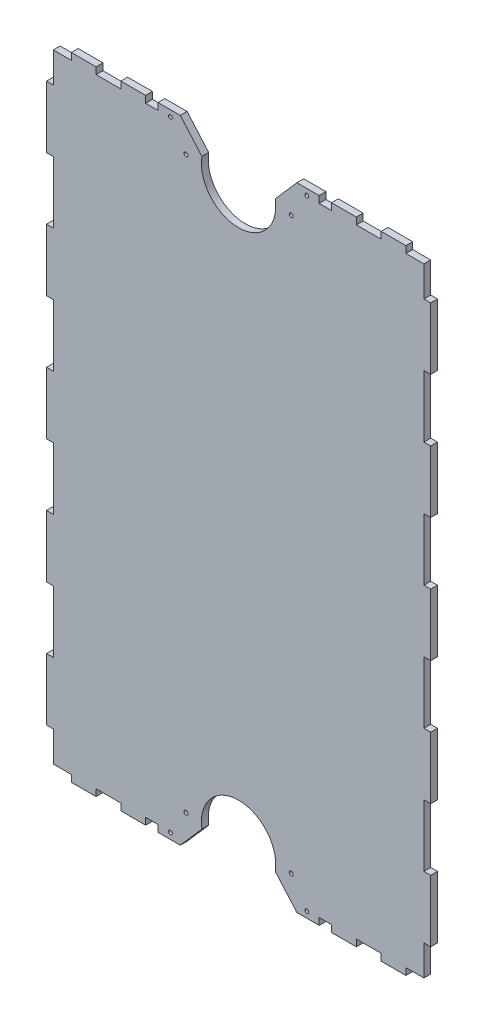
from build123d import *

# Parameters (mm, degrees)
SKETCH_1_W          = 310
SKETCH_1_H          = 510
EXTRUDE_1_DEPTH     = 5.5
SKETCH_2_W          = 5.5
SKETCH_2_H          = 50
CUT_EXTRUDE_1_DEPTH = 299.463146804
CUT_EXTRUDE_2_DEPTH = 299.463146804
SKETCH_5_R          = 1.6
CUT_EXTRUDE_3_DEPTH = 299.463146804
SKETCH_6_R          = 1.55
CUT_EXTRUDE_4_DEPTH = 299.463146804
SKETCH_7_W          = 20
SKETCH_7_H          = 5.5
SKETCH_7_W_2        = 10
CUT_EXTRUDE_5_DEPTH = 299.463146804


with BuildPart() as part:
    # ｽｹｯﾁ1 → ﾎﾞｽ - 押し出し1 (new body)
    with BuildSketch(Plane.XY):
        Rectangle(SKETCH_1_W, SKETCH_1_H)
    extrude(amount=EXTRUDE_1_DEPTH)

    # ｽｹｯﾁ2 → ｶｯﾄ - 押し出し1 (cut, through all)
    with BuildSketch(Plane.XY.offset(5.5)):
        with Locations((152.25, 50)):
            Rectangle(SKETCH_2_W, SKETCH_2_H)
        with Locations((152.25, -50)):
            Rectangle(SKETCH_2_W, SKETCH_2_H)
        with Locations((152.25, 150)):
            Rectangle(SKETCH_2_W, SKETCH_2_H)
        with Locations((152.25, -150)):
            Rectangle(SKETCH_2_W, SKETCH_2_H)
        with Locations((152.25, 250)):
            Rectangle(SKETCH_2_W, SKETCH_2_H)
        with Locations((152.25, -250)):
            Rectangle(SKETCH_2_W, SKETCH_2_H)
        with Locations((-152.25, 50)):
            Rectangle(SKETCH_2_W, SKETCH_2_H)
        with Locations((-152.25, -50)):
            Rectangle(SKETCH_2_W, SKETCH_2_H)
        with Locations((-152.25, 150)):
            Rectangle(SKETCH_2_W, SKETCH_2_H)
        with Locations((-152.25, -150)):
            Rectangle(SKETCH_2_W, SKETCH_2_H)
        with Locations((-152.25, 250)):
            Rectangle(SKETCH_2_W, SKETCH_2_H)
        with Locations((-152.25, -250)):
            Rectangle(SKETCH_2_W, SKETCH_2_H)
    extrude(amount=-CUT_EXTRUDE_1_DEPTH, mode=Mode.SUBTRACT)

    # ｽｹｯﾁ3 → ｶｯﾄ - 押し出し2 (cut, through all)
    with BuildSketch(Plane.XY.offset(5.5)):
        with BuildLine():
            Line((47.033321686, 255), (29.580398915, 235))
            ThreePointArc((29.580398915, 235), (0, 200), (-29.580398915, 235))
            Line((-29.580398915, 235), (-47.033321686, 255))
            Line((-47.033321686, 255), (47.033321686, 255))
        make_face()
        with BuildLine():
            Line((-47.033321686, -255), (-29.580398915, -235))
            ThreePointArc((-29.580398915, -235), (0, -200), (29.580398915, -235))
            Line((29.580398915, -235), (47.033321686, -255))
            Line((47.033321686, -255), (-47.033321686, -255))
        make_face()
    extrude(amount=-CUT_EXTRUDE_2_DEPTH, mode=Mode.SUBTRACT)

    # ｽｹｯﾁ5 → ｶｯﾄ - 押し出し3 (cut, through all)
    with BuildSketch(Plane.XY.offset(5.5)):
        with Locations((-42.5, 230)):
            Circle(SKETCH_5_R)
        with Locations((42.5, 230)):
            Circle(SKETCH_5_R)
        with Locations((42.5, -230)):
            Circle(SKETCH_5_R)
        with Locations((-42.5, -230)):
            Circle(SKETCH_5_R)
    extrude(amount=-CUT_EXTRUDE_3_DEPTH, mode=Mode.SUBTRACT)

    # ｽｹｯﾁ6 → ｶｯﾄ - 押し出し4 (cut, through all)
    with BuildSketch(Plane.XY.offset(5.5)):
        with Locations((55, 250)):
            Circle(SKETCH_6_R)
        with Locations((-55, 250)):
            Circle(SKETCH_6_R)
        with Locations((-55, -250)):
            Circle(SKETCH_6_R)
        with Locations((55, -250)):
            Circle(SKETCH_6_R)
    extrude(amount=-CUT_EXTRUDE_4_DEPTH, mode=Mode.SUBTRACT)

    # ｽｹｯﾁ7 → ｶｯﾄ - 押し出し5 (cut, through all)
    with BuildSketch(Plane.XY.offset(5.5)):
        with Locations((145, 252.25)):
            Rectangle(SKETCH_7_W, SKETCH_7_H)
        with Locations((105, 252.25)):
            Rectangle(SKETCH_7_W, SKETCH_7_H)
        with Locations((70, 252.25)):
            Rectangle(SKETCH_7_W_2, SKETCH_7_H)
        with Locations((-70, 252.25)):
            Rectangle(SKETCH_7_W_2, SKETCH_7_H)
        with Locations((-105, 252.25)):
            Rectangle(SKETCH_7_W, SKETCH_7_H)
        with Locations((-145, 252.25)):
            Rectangle(SKETCH_7_W, SKETCH_7_H)
        with Locations((-145, -252.25)):
            Rectangle(SKETCH_7_W, SKETCH_7_H)
        with Locations((-105, -252.25)):
            Rectangle(SKETCH_7_W, SKETCH_7_H)
        with Locations((-70, -252.25)):
            Rectangle(SKETCH_7_W_2, SKETCH_7_H)
        with Locations((70, -252.25)):
            Rectangle(SKETCH_7_W_2, SKETCH_7_H)
        with Locations((105, -252.25)):
            Rectangle(SKETCH_7_W, SKETCH_7_H)
        with Locations((145, -252.25)):
            Rectangle(SKETCH_7_W, SKETCH_7_H)
    extrude(amount=-CUT_EXTRUDE_5_DEPTH, mode=Mode.SUBTRACT)


solid = part.part
